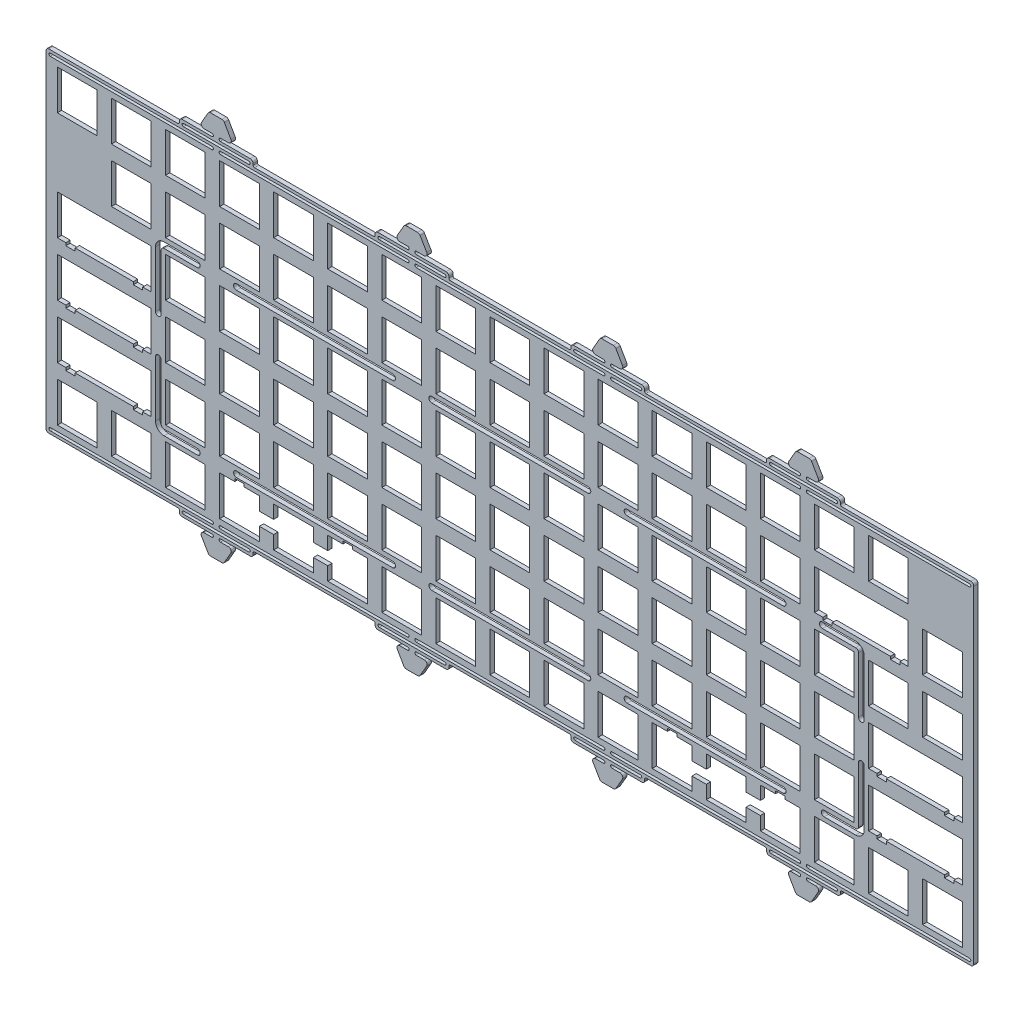
from build123d import *

# Parameters (mm, degrees)
SKETCH2_W           = 344.79935
SKETCH2_H           = 135.24936
SKETCH2_W_2         = 13.999
SKETCH2_H_2         = 14.00086
SKETCH2_W_3         = 14.001
SKETCH2_W_4         = 13.9993
SKETCH2_W_5         = 13.99955
SKETCH2_H_3         = 13.9994
SKETCH2_W_6         = 14.0007
SKETCH2_H_4         = 13.9993
SKETCH2_H_5         = 13.9992
BOSS_EXTRUDE1_DEPTH = 1.524
SKETCH3_W           = 388.73179045
SKETCH3_H           = 165.989329794
CUT_EXTRUDE1_DEPTH  = 186.195516218


with BuildPart() as part:
    # Sketch2 → Boss-Extrude1 (new body)
    with BuildSketch(Plane.XY):
        with Locations((-0.0007173, 0.0004735)):
            Rectangle(SKETCH2_W, SKETCH2_H)
        Polygon((102.2489577, -54.6242065), (102.2489577, -40.6233465), (96.8999577, -40.6233465), (96.8999577, -39.6545865), (93.5999577, -39.6545865), (93.5999577, -40.6233465), (88.2499577, -40.6233465), (88.2499577, -45.3238165), (83.1989577, -45.3238165), (83.1989577, -40.6233465), (69.1999577, -40.6233465), (69.1999577, -45.3238165), (64.1489577, -45.3238165), (64.1489577, -40.6233465), (58.8009577, -40.6233465), (58.8009577, -39.6545865), (55.4999577, -39.6545865), (55.4999577, -40.6233465), (50.1499577, -40.6233465), (50.1499577, -54.6242065), (64.1489577, -54.6242065), (64.1489577, -49.9223065), (69.1999577, -49.9223065), (69.1999577, -54.6242065), (83.1989577, -54.6242065), (83.1989577, -49.9223065), (88.2499577, -49.9223065), (88.2499577, -54.6242065), align=None, mode=Mode.SUBTRACT)
        Polygon((-50.1496423, -54.6242065), (-50.1496423, -40.6233465), (-55.4991423, -40.6233465), (-55.4991423, -39.6545865), (-58.7994423, -39.6545865), (-58.7994423, -40.6233465), (-64.1503423, -40.6233465), (-64.1503423, -45.3238165), (-69.2010423, -45.3238165), (-69.2010423, -40.6233465), (-83.2003423, -40.6233465), (-83.2003423, -45.3238165), (-88.2496423, -45.3238165), (-88.2496423, -40.6233465), (-93.6003423, -40.6233465), (-93.6003423, -39.6545865), (-96.9003423, -39.6545865), (-96.9003423, -40.6233465), (-102.2503423, -40.6233465), (-102.2503423, -54.6242065), (-88.2496423, -54.6242065), (-88.2496423, -49.9223065), (-83.2003423, -49.9223065), (-83.2003423, -54.6242065), (-69.2010423, -54.6242065), (-69.2010423, -49.9223065), (-64.1503423, -49.9223065), (-64.1503423, -54.6242065), align=None, mode=Mode.SUBTRACT)
        with Locations((152.3994577, -47.6237765)):
            Rectangle(SKETCH2_W_2, SKETCH2_H_2, mode=Mode.SUBTRACT)
        with Locations((133.3494577, -47.6237765)):
            Rectangle(SKETCH2_W_2, SKETCH2_H_2, mode=Mode.SUBTRACT)
        with Locations((114.2994577, -47.6237765)):
            Rectangle(SKETCH2_W_2, SKETCH2_H_2, mode=Mode.SUBTRACT)
        with Locations((38.0994577, -47.6237765)):
            Rectangle(SKETCH2_W_2, SKETCH2_H_2, mode=Mode.SUBTRACT)
        with Locations((19.0494577, -47.6237765)):
            Rectangle(SKETCH2_W_2, SKETCH2_H_2, mode=Mode.SUBTRACT)
        with Locations((-0.0005423, -47.6237765)):
            Rectangle(SKETCH2_W_2, SKETCH2_H_2, mode=Mode.SUBTRACT)
        with Locations((-19.0505423, -47.6237765)):
            Rectangle(SKETCH2_W_2, SKETCH2_H_2, mode=Mode.SUBTRACT)
        with Locations((-38.1015423, -47.6237765)):
            Rectangle(SKETCH2_W_3, SKETCH2_H_2, mode=Mode.SUBTRACT)
        with Locations((-114.3006923, -47.6237765)):
            Rectangle(SKETCH2_W_4, SKETCH2_H_2, mode=Mode.SUBTRACT)
        with Locations((-133.3506923, -47.6237765)):
            Rectangle(SKETCH2_W_4, SKETCH2_H_2, mode=Mode.SUBTRACT)
        with Locations((-152.4006173, -47.6237765)):
            Rectangle(SKETCH2_W_5, SKETCH2_H_2, mode=Mode.SUBTRACT)
        Polygon((126.3499577, -21.5748465), (126.3499577, -35.5742465), (129.3249577, -35.5742465), (129.3249577, -36.5443465), (132.6239577, -36.5443465), (132.6239577, -35.5742465), (153.1249577, -35.5742465), (153.1249577, -36.5443465), (156.4239577, -36.5443465), (156.4239577, -35.5742465), (159.3989577, -35.5742465), (159.3989577, -21.5748465), align=None, mode=Mode.SUBTRACT)
        Polygon((-159.4003923, -21.5748465), (-159.4003923, -35.5742465), (-156.4252023, -35.5742465), (-156.4252023, -36.5443465), (-153.1262023, -36.5443465), (-153.1262023, -35.5742465), (-132.6251423, -35.5742465), (-132.6251423, -36.5443465), (-129.3260423, -36.5443465), (-129.3260423, -35.5742465), (-126.3510423, -35.5742465), (-126.3510423, -21.5748465), align=None, mode=Mode.SUBTRACT)
        with Locations((114.2994577, -28.5745465)):
            Rectangle(SKETCH2_W_2, SKETCH2_H_3, mode=Mode.SUBTRACT)
        with Locations((95.2494577, -28.5745465)):
            Rectangle(SKETCH2_W_2, SKETCH2_H_3, mode=Mode.SUBTRACT)
        with Locations((76.1994577, -28.5745465)):
            Rectangle(SKETCH2_W_2, SKETCH2_H_3, mode=Mode.SUBTRACT)
        with Locations((57.1494577, -28.5745465)):
            Rectangle(SKETCH2_W_2, SKETCH2_H_3, mode=Mode.SUBTRACT)
        with Locations((38.0994577, -28.5745465)):
            Rectangle(SKETCH2_W_2, SKETCH2_H_3, mode=Mode.SUBTRACT)
        with Locations((19.0494577, -28.5745465)):
            Rectangle(SKETCH2_W_2, SKETCH2_H_3, mode=Mode.SUBTRACT)
        with Locations((-0.0005423, -28.5745465)):
            Rectangle(SKETCH2_W_2, SKETCH2_H_3, mode=Mode.SUBTRACT)
        with Locations((-19.0505423, -28.5745465)):
            Rectangle(SKETCH2_W_2, SKETCH2_H_3, mode=Mode.SUBTRACT)
        with Locations((-38.1015423, -28.5745465)):
            Rectangle(SKETCH2_W_3, SKETCH2_H_3, mode=Mode.SUBTRACT)
        with Locations((-57.1513923, -28.5745465)):
            Rectangle(SKETCH2_W_6, SKETCH2_H_3, mode=Mode.SUBTRACT)
        with Locations((-76.2006923, -28.5745465)):
            Rectangle(SKETCH2_W_4, SKETCH2_H_3, mode=Mode.SUBTRACT)
        with Locations((-95.2506923, -28.5745465)):
            Rectangle(SKETCH2_W_4, SKETCH2_H_3, mode=Mode.SUBTRACT)
        with Locations((-114.3006923, -28.5745465)):
            Rectangle(SKETCH2_W_4, SKETCH2_H_3, mode=Mode.SUBTRACT)
        Polygon((126.3499577, -2.5247465), (126.3499577, -16.5240465), (129.3249577, -16.5240465), (129.3249577, -17.4942465), (132.6239577, -17.4942465), (132.6239577, -16.5240465), (153.1249577, -16.5240465), (153.1249577, -17.4942465), (156.4239577, -17.4942465), (156.4239577, -16.5240465), (159.3989577, -16.5240465), (159.3989577, -2.5247465), align=None, mode=Mode.SUBTRACT)
        Polygon((-159.4003923, -2.5247465), (-159.4003923, -16.5240465), (-156.4252023, -16.5240465), (-156.4252023, -17.4942465), (-153.1262023, -17.4942465), (-153.1262023, -16.5240465), (-132.6251423, -16.5240465), (-132.6251423, -17.4942465), (-129.3260423, -17.4942465), (-129.3260423, -16.5240465), (-126.3510423, -16.5240465), (-126.3510423, -2.5247465), align=None, mode=Mode.SUBTRACT)
        with Locations((114.2994577, -9.5243965)):
            Rectangle(SKETCH2_W_2, SKETCH2_H_4, mode=Mode.SUBTRACT)
        with Locations((95.2494577, -9.5243965)):
            Rectangle(SKETCH2_W_2, SKETCH2_H_4, mode=Mode.SUBTRACT)
        with Locations((76.1994577, -9.5243965)):
            Rectangle(SKETCH2_W_2, SKETCH2_H_4, mode=Mode.SUBTRACT)
        with Locations((57.1494577, -9.5243965)):
            Rectangle(SKETCH2_W_2, SKETCH2_H_4, mode=Mode.SUBTRACT)
        with Locations((38.0994577, -9.5243965)):
            Rectangle(SKETCH2_W_2, SKETCH2_H_4, mode=Mode.SUBTRACT)
        with Locations((19.0494577, -9.5243965)):
            Rectangle(SKETCH2_W_2, SKETCH2_H_4, mode=Mode.SUBTRACT)
        with Locations((-0.0005423, -9.5243965)):
            Rectangle(SKETCH2_W_2, SKETCH2_H_4, mode=Mode.SUBTRACT)
        with Locations((-19.0505423, -9.5243965)):
            Rectangle(SKETCH2_W_2, SKETCH2_H_4, mode=Mode.SUBTRACT)
        with Locations((-38.1015423, -9.5243965)):
            Rectangle(SKETCH2_W_3, SKETCH2_H_4, mode=Mode.SUBTRACT)
        with Locations((-57.1513923, -9.5243965)):
            Rectangle(SKETCH2_W_6, SKETCH2_H_4, mode=Mode.SUBTRACT)
        with Locations((-76.2006923, -9.5243965)):
            Rectangle(SKETCH2_W_4, SKETCH2_H_4, mode=Mode.SUBTRACT)
        with Locations((-95.2506923, -9.5243965)):
            Rectangle(SKETCH2_W_4, SKETCH2_H_4, mode=Mode.SUBTRACT)
        with Locations((-114.3006923, -9.5243965)):
            Rectangle(SKETCH2_W_4, SKETCH2_H_4, mode=Mode.SUBTRACT)
        Polygon((-159.4003923, 16.5252535), (-159.4003923, 2.5259535), (-156.4252023, 2.5259535), (-156.4252023, 1.5557535), (-153.1262023, 1.5557535), (-153.1262023, 2.5259535), (-132.6251423, 2.5259535), (-132.6251423, 1.5557535), (-129.3260423, 1.5557535), (-129.3260423, 2.5259535), (-126.3510423, 2.5259535), (-126.3510423, 16.5252535), align=None, mode=Mode.SUBTRACT)
        with Locations((152.3994577, 9.5256035)):
            Rectangle(SKETCH2_W_2, SKETCH2_H_4, mode=Mode.SUBTRACT)
        with Locations((133.3494577, 9.5256035)):
            Rectangle(SKETCH2_W_2, SKETCH2_H_4, mode=Mode.SUBTRACT)
        with Locations((114.2994577, 9.5256035)):
            Rectangle(SKETCH2_W_2, SKETCH2_H_4, mode=Mode.SUBTRACT)
        with Locations((95.2494577, 9.5256035)):
            Rectangle(SKETCH2_W_2, SKETCH2_H_4, mode=Mode.SUBTRACT)
        with Locations((76.1994577, 9.5256035)):
            Rectangle(SKETCH2_W_2, SKETCH2_H_4, mode=Mode.SUBTRACT)
        with Locations((57.1494577, 9.5256035)):
            Rectangle(SKETCH2_W_2, SKETCH2_H_4, mode=Mode.SUBTRACT)
        with Locations((38.0994577, 9.5256035)):
            Rectangle(SKETCH2_W_2, SKETCH2_H_4, mode=Mode.SUBTRACT)
        with Locations((19.0494577, 9.5256035)):
            Rectangle(SKETCH2_W_2, SKETCH2_H_4, mode=Mode.SUBTRACT)
        with Locations((-0.0005423, 9.5256035)):
            Rectangle(SKETCH2_W_2, SKETCH2_H_4, mode=Mode.SUBTRACT)
        with Locations((-19.0505423, 9.5256035)):
            Rectangle(SKETCH2_W_2, SKETCH2_H_4, mode=Mode.SUBTRACT)
        with Locations((-38.1015423, 9.5256035)):
            Rectangle(SKETCH2_W_3, SKETCH2_H_4, mode=Mode.SUBTRACT)
        with Locations((-57.1513923, 9.5256035)):
            Rectangle(SKETCH2_W_6, SKETCH2_H_4, mode=Mode.SUBTRACT)
        with Locations((-76.2006923, 9.5256035)):
            Rectangle(SKETCH2_W_4, SKETCH2_H_4, mode=Mode.SUBTRACT)
        with Locations((-95.2506923, 9.5256035)):
            Rectangle(SKETCH2_W_4, SKETCH2_H_4, mode=Mode.SUBTRACT)
        with Locations((-114.3006923, 9.5256035)):
            Rectangle(SKETCH2_W_4, SKETCH2_H_4, mode=Mode.SUBTRACT)
        Polygon((107.2999577, 35.5752535), (107.2999577, 21.5759535), (110.2749577, 21.5759535), (110.2749577, 20.6057535), (113.5739577, 20.6057535), (113.5739577, 21.5759535), (134.0749577, 21.5759535), (134.0749577, 20.6057535), (137.3739577, 20.6057535), (137.3739577, 21.5759535), (140.3489577, 21.5759535), (140.3489577, 35.5752535), align=None, mode=Mode.SUBTRACT)
        with Locations((152.3994577, 28.5756035)):
            Rectangle(SKETCH2_W_2, SKETCH2_H_4, mode=Mode.SUBTRACT)
        with Locations((95.2494577, 28.5756035)):
            Rectangle(SKETCH2_W_2, SKETCH2_H_4, mode=Mode.SUBTRACT)
        with Locations((76.1994577, 28.5756035)):
            Rectangle(SKETCH2_W_2, SKETCH2_H_4, mode=Mode.SUBTRACT)
        with Locations((57.1494577, 28.5756035)):
            Rectangle(SKETCH2_W_2, SKETCH2_H_4, mode=Mode.SUBTRACT)
        with Locations((38.0994577, 28.5756035)):
            Rectangle(SKETCH2_W_2, SKETCH2_H_4, mode=Mode.SUBTRACT)
        with Locations((19.0494577, 28.5756035)):
            Rectangle(SKETCH2_W_2, SKETCH2_H_4, mode=Mode.SUBTRACT)
        with Locations((-0.0005423, 28.5756035)):
            Rectangle(SKETCH2_W_2, SKETCH2_H_4, mode=Mode.SUBTRACT)
        with Locations((-19.0505423, 28.5756035)):
            Rectangle(SKETCH2_W_2, SKETCH2_H_4, mode=Mode.SUBTRACT)
        with Locations((-38.1015423, 28.5756035)):
            Rectangle(SKETCH2_W_3, SKETCH2_H_4, mode=Mode.SUBTRACT)
        with Locations((-57.1513923, 28.5756035)):
            Rectangle(SKETCH2_W_6, SKETCH2_H_4, mode=Mode.SUBTRACT)
        with Locations((-76.2006923, 28.5756035)):
            Rectangle(SKETCH2_W_4, SKETCH2_H_4, mode=Mode.SUBTRACT)
        with Locations((-95.2506923, 28.5756035)):
            Rectangle(SKETCH2_W_4, SKETCH2_H_4, mode=Mode.SUBTRACT)
        with Locations((-114.3006923, 28.5756035)):
            Rectangle(SKETCH2_W_4, SKETCH2_H_4, mode=Mode.SUBTRACT)
        with Locations((-133.3506923, 28.5756035)):
            Rectangle(SKETCH2_W_4, SKETCH2_H_4, mode=Mode.SUBTRACT)
        with Locations((133.3494577, 47.6255535)):
            Rectangle(SKETCH2_W_2, SKETCH2_H_5, mode=Mode.SUBTRACT)
        with Locations((114.2994577, 47.6255535)):
            Rectangle(SKETCH2_W_2, SKETCH2_H_5, mode=Mode.SUBTRACT)
        with Locations((95.2494577, 47.6255535)):
            Rectangle(SKETCH2_W_2, SKETCH2_H_5, mode=Mode.SUBTRACT)
        with Locations((76.1994577, 47.6255535)):
            Rectangle(SKETCH2_W_2, SKETCH2_H_5, mode=Mode.SUBTRACT)
        with Locations((57.1494577, 47.6255535)):
            Rectangle(SKETCH2_W_2, SKETCH2_H_5, mode=Mode.SUBTRACT)
        with Locations((38.0994577, 47.6255535)):
            Rectangle(SKETCH2_W_2, SKETCH2_H_5, mode=Mode.SUBTRACT)
        with Locations((19.0494577, 47.6255535)):
            Rectangle(SKETCH2_W_2, SKETCH2_H_5, mode=Mode.SUBTRACT)
        with Locations((-0.0005423, 47.6255535)):
            Rectangle(SKETCH2_W_2, SKETCH2_H_5, mode=Mode.SUBTRACT)
        with Locations((-19.0505423, 47.6255535)):
            Rectangle(SKETCH2_W_2, SKETCH2_H_5, mode=Mode.SUBTRACT)
        with Locations((-38.1015423, 47.6255535)):
            Rectangle(SKETCH2_W_3, SKETCH2_H_5, mode=Mode.SUBTRACT)
        with Locations((-57.1513923, 47.6255535)):
            Rectangle(SKETCH2_W_6, SKETCH2_H_5, mode=Mode.SUBTRACT)
        with Locations((-76.2006923, 47.6255535)):
            Rectangle(SKETCH2_W_4, SKETCH2_H_5, mode=Mode.SUBTRACT)
        with Locations((-95.2506923, 47.6255535)):
            Rectangle(SKETCH2_W_4, SKETCH2_H_5, mode=Mode.SUBTRACT)
        with Locations((-114.3006923, 47.6255535)):
            Rectangle(SKETCH2_W_4, SKETCH2_H_5, mode=Mode.SUBTRACT)
        with Locations((-133.3506923, 47.6255535)):
            Rectangle(SKETCH2_W_4, SKETCH2_H_5, mode=Mode.SUBTRACT)
        with Locations((-152.4006173, 47.6255535)):
            Rectangle(SKETCH2_W_5, SKETCH2_H_5, mode=Mode.SUBTRACT)
    extrude(amount=BOSS_EXTRUDE1_DEPTH)

    # Sketch3 → Cut-Extrude1 (cut, through all)
    # profile 1 of 29: a face of its own
    with BuildSketch(Plane.XY.offset(1.524)):
        Rectangle(SKETCH3_W, SKETCH3_H)
        with BuildLine():
            ThreePointArc((-105.4405223, -67.6242065), (-105.9405223, -67.490231904), (-106.306547704, -67.1242065))
            Line((-106.306547704, -67.1242065), (-108.615948781, -63.1242065))
            ThreePointArc((-108.615948781, -63.1242065), (-108.615948781, -62.1242065), (-107.749923377, -61.6242065))
            Line((-107.749923377, -61.6242065), (-104.9405223, -61.6242065))
            ThreePointArc((-104.9405223, -61.6242065), (-104.4405223, -61.1242065), (-104.9405223, -60.6242065))
            Line((-104.9405223, -60.6242065), (-115.4405223, -60.6242065))
            ThreePointArc((-115.4405223, -60.6242065), (-116.147629081, -60.331313281), (-116.4405223, -59.6242065))
            Line((-116.4405223, -59.6242065), (-116.4405223, -59.1241965))
            ThreePointArc((-116.4405223, -59.1241965), (-116.58696598, -58.77065018), (-116.9405123, -58.6242065))
            Line((-116.9405123, -58.6242065), (-162.4003923, -58.6242065))
            ThreePointArc((-162.4003923, -58.6242065), (-163.107499081, -58.331313281), (-163.4003923, -57.6242065))
            Line((-163.4003923, -57.6242065), (-163.4003923, 57.6242065))
            ThreePointArc((-163.4003923, 57.6242065), (-163.107499081, 58.331313281), (-162.4003923, 58.6242065))
            Line((-162.4003923, 58.6242065), (-116.9405123, 58.6242065))
            ThreePointArc((-116.9405123, 58.6242065), (-116.58696598, 58.77065018), (-116.4405223, 59.1241965))
            Line((-116.4405223, 59.1241965), (-116.4405223, 59.6242065))
            ThreePointArc((-116.4405223, 59.6242065), (-116.147629081, 60.331313281), (-115.4405223, 60.6242065))
            Line((-115.4405223, 60.6242065), (-104.9405223, 60.6242065))
            ThreePointArc((-104.9405223, 60.6242065), (-104.4405223, 61.1242065), (-104.9405223, 61.6242065))
            Line((-104.9405223, 61.6242065), (-107.749923377, 61.6242065))
            ThreePointArc((-107.749923377, 61.6242065), (-108.615948781, 62.1242065), (-108.615948781, 63.1242065))
            Line((-108.615948781, 63.1242065), (-106.306547704, 67.1242065))
            ThreePointArc((-106.306547704, 67.1242065), (-105.9405223, 67.490231904), (-105.4405223, 67.6242065))
            Line((-105.4405223, 67.6242065), (-101.4405223, 67.6242065))
            ThreePointArc((-101.4405223, 67.6242065), (-100.9405223, 67.490231904), (-100.574496896, 67.1242065))
            Line((-100.574496896, 67.1242065), (-98.265095819, 63.1242065))
            ThreePointArc((-98.265095819, 63.1242065), (-98.265095819, 62.1242065), (-99.131121223, 61.6242065))
            Line((-99.131121223, 61.6242065), (-101.9405223, 61.6242065))
            ThreePointArc((-101.9405223, 61.6242065), (-102.4405223, 61.1242065), (-101.9405223, 60.6242065))
            Line((-101.9405223, 60.6242065), (-91.4405223, 60.6242065))
            ThreePointArc((-91.4405223, 60.6242065), (-90.733415519, 60.331313281), (-90.4405223, 59.6242065))
            Line((-90.4405223, 59.6242065), (-90.4405223, 59.1241965))
            ThreePointArc((-90.4405223, 59.1241965), (-90.29407862, 58.77065018), (-89.9405323, 58.6242065))
            Line((-89.9405323, 58.6242065), (-47.9806423, 58.6242065))
            ThreePointArc((-47.9806423, 58.6242065), (-47.62709598, 58.77065018), (-47.4806523, 59.1241965))
            Line((-47.4806523, 59.1241965), (-47.4806523, 59.6242065))
            ThreePointArc((-47.4806523, 59.6242065), (-47.187759081, 60.331313281), (-46.4806523, 60.6242065))
            Line((-46.4806523, 60.6242065), (-35.9806523, 60.6242065))
            ThreePointArc((-35.9806523, 60.6242065), (-35.4806523, 61.1242065), (-35.9806523, 61.6242065))
            Line((-35.9806523, 61.6242065), (-38.790053377, 61.6242065))
            ThreePointArc((-38.790053377, 61.6242065), (-39.656078781, 62.1242065), (-39.656078781, 63.1242065))
            Line((-39.656078781, 63.1242065), (-37.346677704, 67.1242065))
            ThreePointArc((-37.346677704, 67.1242065), (-36.9806523, 67.490231904), (-36.4806523, 67.6242065))
            Line((-36.4806523, 67.6242065), (-32.4806523, 67.6242065))
            ThreePointArc((-32.4806523, 67.6242065), (-31.9806523, 67.490231904), (-31.614626896, 67.1242065))
            Line((-31.614626896, 67.1242065), (-29.305225819, 63.1242065))
            ThreePointArc((-29.305225819, 63.1242065), (-29.305225819, 62.1242065), (-30.171251223, 61.6242065))
            Line((-30.171251223, 61.6242065), (-32.9806523, 61.6242065))
            ThreePointArc((-32.9806523, 61.6242065), (-33.4806523, 61.1242065), (-32.9806523, 60.6242065))
            Line((-32.9806523, 60.6242065), (-22.4806523, 60.6242065))
            ThreePointArc((-22.4806523, 60.6242065), (-21.773545519, 60.331313281), (-21.4806523, 59.6242065))
            Line((-21.4806523, 59.6242065), (-21.4806523, 59.1241965))
            ThreePointArc((-21.4806523, 59.1241965), (-21.33420862, 58.77065018), (-20.9806623, 58.6242065))
            Line((-20.9806623, 58.6242065), (20.9792277, 58.6242065))
            ThreePointArc((20.9792277, 58.6242065), (21.33277402, 58.77065018), (21.4792177, 59.1241965))
            Line((21.4792177, 59.1241965), (21.4792177, 59.6242065))
            ThreePointArc((21.4792177, 59.6242065), (21.772110919, 60.331313281), (22.4792177, 60.6242065))
            Line((22.4792177, 60.6242065), (32.9792177, 60.6242065))
            ThreePointArc((32.9792177, 60.6242065), (33.4792177, 61.1242065), (32.9792177, 61.6242065))
            Line((32.9792177, 61.6242065), (30.169816623, 61.6242065))
            ThreePointArc((30.169816623, 61.6242065), (29.303791219, 62.1242065), (29.303791219, 63.1242065))
            Line((29.303791219, 63.1242065), (31.613192296, 67.1242065))
            ThreePointArc((31.613192296, 67.1242065), (31.9792177, 67.490231904), (32.4792177, 67.6242065))
            Line((32.4792177, 67.6242065), (36.4792177, 67.6242065))
            ThreePointArc((36.4792177, 67.6242065), (36.9792177, 67.490231904), (37.345243104, 67.1242065))
            Line((37.345243104, 67.1242065), (39.654644181, 63.1242065))
            ThreePointArc((39.654644181, 63.1242065), (39.654644181, 62.1242065), (38.788618777, 61.6242065))
            Line((38.788618777, 61.6242065), (35.9792177, 61.6242065))
            ThreePointArc((35.9792177, 61.6242065), (35.4792177, 61.1242065), (35.9792177, 60.6242065))
            Line((35.9792177, 60.6242065), (46.4792177, 60.6242065))
            ThreePointArc((46.4792177, 60.6242065), (47.186324481, 60.331313281), (47.4792177, 59.6242065))
            Line((47.4792177, 59.6242065), (47.4792177, 59.1241965))
            ThreePointArc((47.4792177, 59.1241965), (47.62566138, 58.77065018), (47.9792077, 58.6242065))
            Line((47.9792077, 58.6242065), (89.9390977, 58.6242065))
            ThreePointArc((89.9390977, 58.6242065), (90.29264402, 58.77065018), (90.4390877, 59.1241965))
            Line((90.4390877, 59.1241965), (90.4390877, 59.6242065))
            ThreePointArc((90.4390877, 59.6242065), (90.731980919, 60.331313281), (91.4390877, 60.6242065))
            Line((91.4390877, 60.6242065), (101.9390877, 60.6242065))
            ThreePointArc((101.9390877, 60.6242065), (102.4390877, 61.1242065), (101.9390877, 61.6242065))
            Line((101.9390877, 61.6242065), (99.129686623, 61.6242065))
            ThreePointArc((99.129686623, 61.6242065), (98.263661219, 62.1242065), (98.263661219, 63.1242065))
            Line((98.263661219, 63.1242065), (100.573062296, 67.1242065))
            ThreePointArc((100.573062296, 67.1242065), (100.9390877, 67.490231904), (101.4390877, 67.6242065))
            Line((101.4390877, 67.6242065), (105.4390877, 67.6242065))
            ThreePointArc((105.4390877, 67.6242065), (105.9390877, 67.490231904), (106.305113104, 67.1242065))
            Line((106.305113104, 67.1242065), (108.614514181, 63.1242065))
            ThreePointArc((108.614514181, 63.1242065), (108.614514181, 62.1242065), (107.748488777, 61.6242065))
            Line((107.748488777, 61.6242065), (104.9390877, 61.6242065))
            ThreePointArc((104.9390877, 61.6242065), (104.4390877, 61.1242065), (104.9390877, 60.6242065))
            Line((104.9390877, 60.6242065), (115.4390877, 60.6242065))
            ThreePointArc((115.4390877, 60.6242065), (116.146194481, 60.331313281), (116.4390877, 59.6242065))
            Line((116.4390877, 59.6242065), (116.4390877, 59.1241965))
            ThreePointArc((116.4390877, 59.1241965), (116.58553138, 58.77065018), (116.9390777, 58.6242065))
            Line((116.9390777, 58.6242065), (162.3989577, 58.6242065))
            ThreePointArc((162.3989577, 58.6242065), (163.106064481, 58.331313281), (163.3989577, 57.6242065))
            Line((163.3989577, 57.6242065), (163.3989577, -57.6242065))
            ThreePointArc((163.3989577, -57.6242065), (163.106064481, -58.331313281), (162.3989577, -58.6242065))
            Line((162.3989577, -58.6242065), (116.9390777, -58.6242065))
            ThreePointArc((116.9390777, -58.6242065), (116.58553138, -58.77065018), (116.4390877, -59.1241965))
            Line((116.4390877, -59.1241965), (116.4390877, -59.6242065))
            ThreePointArc((116.4390877, -59.6242065), (116.146194481, -60.331313281), (115.4390877, -60.6242065))
            Line((115.4390877, -60.6242065), (104.9390877, -60.6242065))
            ThreePointArc((104.9390877, -60.6242065), (104.4390877, -61.1242065), (104.9390877, -61.6242065))
            Line((104.9390877, -61.6242065), (107.748488777, -61.6242065))
            ThreePointArc((107.748488777, -61.6242065), (108.614514181, -62.1242065), (108.614514181, -63.1242065))
            Line((108.614514181, -63.1242065), (106.305113104, -67.1242065))
            ThreePointArc((106.305113104, -67.1242065), (105.9390877, -67.490231904), (105.4390877, -67.6242065))
            Line((105.4390877, -67.6242065), (101.4390877, -67.6242065))
            ThreePointArc((101.4390877, -67.6242065), (100.9390877, -67.490231904), (100.573062296, -67.1242065))
            Line((100.573062296, -67.1242065), (98.263661219, -63.1242065))
            ThreePointArc((98.263661219, -63.1242065), (98.263661219, -62.1242065), (99.129686623, -61.6242065))
            Line((99.129686623, -61.6242065), (101.9390877, -61.6242065))
            ThreePointArc((101.9390877, -61.6242065), (102.4390877, -61.1242065), (101.9390877, -60.6242065))
            Line((101.9390877, -60.6242065), (91.4390877, -60.6242065))
            ThreePointArc((91.4390877, -60.6242065), (90.731980919, -60.331313281), (90.4390877, -59.6242065))
            Line((90.4390877, -59.6242065), (90.4390877, -59.1241965))
            ThreePointArc((90.4390877, -59.1241965), (90.29264402, -58.77065018), (89.9390977, -58.6242065))
            Line((89.9390977, -58.6242065), (47.9792077, -58.6242065))
            ThreePointArc((47.9792077, -58.6242065), (47.62566138, -58.77065018), (47.4792177, -59.1241965))
            Line((47.4792177, -59.1241965), (47.4792177, -59.6242065))
            ThreePointArc((47.4792177, -59.6242065), (47.186324481, -60.331313281), (46.4792177, -60.6242065))
            Line((46.4792177, -60.6242065), (35.9792177, -60.6242065))
            ThreePointArc((35.9792177, -60.6242065), (35.4792177, -61.1242065), (35.9792177, -61.6242065))
            Line((35.9792177, -61.6242065), (38.788618777, -61.6242065))
            ThreePointArc((38.788618777, -61.6242065), (39.654644181, -62.1242065), (39.654644181, -63.1242065))
            Line((39.654644181, -63.1242065), (37.345243104, -67.1242065))
            ThreePointArc((37.345243104, -67.1242065), (36.9792177, -67.490231904), (36.4792177, -67.6242065))
            Line((36.4792177, -67.6242065), (32.4792177, -67.6242065))
            ThreePointArc((32.4792177, -67.6242065), (31.9792177, -67.490231904), (31.613192296, -67.1242065))
            Line((31.613192296, -67.1242065), (29.303791219, -63.1242065))
            ThreePointArc((29.303791219, -63.1242065), (29.303791219, -62.1242065), (30.169816623, -61.6242065))
            Line((30.169816623, -61.6242065), (32.9792177, -61.6242065))
            ThreePointArc((32.9792177, -61.6242065), (33.4792177, -61.1242065), (32.9792177, -60.6242065))
            Line((32.9792177, -60.6242065), (22.4792177, -60.6242065))
            ThreePointArc((22.4792177, -60.6242065), (21.772110919, -60.331313281), (21.4792177, -59.6242065))
            Line((21.4792177, -59.6242065), (21.4792177, -59.1241965))
            ThreePointArc((21.4792177, -59.1241965), (21.33277402, -58.77065018), (20.9792277, -58.6242065))
            Line((20.9792277, -58.6242065), (-20.9806623, -58.6242065))
            ThreePointArc((-20.9806623, -58.6242065), (-21.33420862, -58.77065018), (-21.4806523, -59.1241965))
            Line((-21.4806523, -59.1241965), (-21.4806523, -59.6242065))
            ThreePointArc((-21.4806523, -59.6242065), (-21.773545519, -60.331313281), (-22.4806523, -60.6242065))
            Line((-22.4806523, -60.6242065), (-32.9806523, -60.6242065))
            ThreePointArc((-32.9806523, -60.6242065), (-33.4806523, -61.1242065), (-32.9806523, -61.6242065))
            Line((-32.9806523, -61.6242065), (-30.171251223, -61.6242065))
            ThreePointArc((-30.171251223, -61.6242065), (-29.305225819, -62.1242065), (-29.305225819, -63.1242065))
            Line((-29.305225819, -63.1242065), (-31.614626896, -67.1242065))
            ThreePointArc((-31.614626896, -67.1242065), (-31.9806523, -67.490231904), (-32.4806523, -67.6242065))
            Line((-32.4806523, -67.6242065), (-36.4806523, -67.6242065))
            ThreePointArc((-36.4806523, -67.6242065), (-36.9806523, -67.490231904), (-37.346677704, -67.1242065))
            Line((-37.346677704, -67.1242065), (-39.656078781, -63.1242065))
            ThreePointArc((-39.656078781, -63.1242065), (-39.656078781, -62.1242065), (-38.790053377, -61.6242065))
            Line((-38.790053377, -61.6242065), (-35.9806523, -61.6242065))
            ThreePointArc((-35.9806523, -61.6242065), (-35.4806523, -61.1242065), (-35.9806523, -60.6242065))
            Line((-35.9806523, -60.6242065), (-46.4806523, -60.6242065))
            ThreePointArc((-46.4806523, -60.6242065), (-47.187759081, -60.331313281), (-47.4806523, -59.6242065))
            Line((-47.4806523, -59.6242065), (-47.4806523, -59.1241965))
            ThreePointArc((-47.4806523, -59.1241965), (-47.62709598, -58.77065018), (-47.9806423, -58.6242065))
            Line((-47.9806423, -58.6242065), (-89.9405323, -58.6242065))
            ThreePointArc((-89.9405323, -58.6242065), (-90.29407862, -58.77065018), (-90.4405223, -59.1241965))
            Line((-90.4405223, -59.1241965), (-90.4405223, -59.6242065))
            ThreePointArc((-90.4405223, -59.6242065), (-90.733415519, -60.331313281), (-91.4405223, -60.6242065))
            Line((-91.4405223, -60.6242065), (-101.9405223, -60.6242065))
            ThreePointArc((-101.9405223, -60.6242065), (-102.4405223, -61.1242065), (-101.9405223, -61.6242065))
            Line((-101.9405223, -61.6242065), (-99.131121223, -61.6242065))
            ThreePointArc((-99.131121223, -61.6242065), (-98.265095819, -62.1242065), (-98.265095819, -63.1242065))
            Line((-98.265095819, -63.1242065), (-100.574496896, -67.1242065))
            ThreePointArc((-100.574496896, -67.1242065), (-100.9405223, -67.490231904), (-101.4405223, -67.6242065))
            Line((-101.4405223, -67.6242065), (-105.4405223, -67.6242065))
        make_face(mode=Mode.SUBTRACT)
    # profile 2 of 29: a face of its own
    with BuildSketch(Plane.XY.offset(1.524)):
        with BuildLine():
            Line((110.066116033, 18.0506035), (121.8244577, 18.0506035))
            ThreePointArc((121.8244577, 18.0506035), (122.531564481, 17.757710281), (122.8244577, 17.0506035))
            Line((122.8244577, 17.0506035), (122.8244577, -2.6440965))
            ThreePointArc((122.8244577, -2.6440965), (123.8244577, -3.6440965), (124.8244577, -2.6440965))
            Line((124.8244577, -2.6440965), (124.8244577, 17.0506035))
            ThreePointArc((124.8244577, 17.0506035), (123.945778044, 19.171923844), (121.8244577, 20.0506035))
            Line((121.8244577, 20.0506035), (110.066116033, 20.0506035))
            ThreePointArc((110.066116033, 20.0506035), (109.066116033, 19.0506035), (110.066116033, 18.0506035))
        make_face()
    # profile 3 of 29: a face of its own
    with BuildSketch(Plane.XY.offset(1.524)):
        with BuildLine():
            ThreePointArc((110.718180633, -37.0987965), (109.718180633, -38.0987965), (110.718180633, -39.0987965))
            Line((110.718180633, -39.0987965), (121.8244577, -39.0987965))
            ThreePointArc((121.8244577, -39.0987965), (123.945778044, -38.220116844), (124.8244577, -36.0987965))
            Line((124.8244577, -36.0987965), (124.8244577, -16.4040965))
            ThreePointArc((124.8244577, -16.4040965), (123.8244577, -15.4040965), (122.8244577, -16.4040965))
            Line((122.8244577, -16.4040965), (122.8244577, -36.0987965))
            ThreePointArc((122.8244577, -36.0987965), (122.531564481, -36.805903281), (121.8244577, -37.0987965))
            Line((121.8244577, -37.0987965), (110.718180633, -37.0987965))
        make_face()
    # profile 4 of 29: a face of its own
    with BuildSketch(Plane.XY.offset(1.524)):
        with BuildLine():
            ThreePointArc((-110.067350633, 18.0506035), (-109.067350633, 19.0506035), (-110.067350633, 20.0506035))
            Line((-110.067350633, 20.0506035), (-121.8256923, 20.0506035))
            ThreePointArc((-121.8256923, 20.0506035), (-123.947012644, 19.171923844), (-124.8256923, 17.0506035))
            Line((-124.8256923, 17.0506035), (-124.8256923, -2.6440965))
            ThreePointArc((-124.8256923, -2.6440965), (-123.8256923, -3.6440965), (-122.8256923, -2.6440965))
            Line((-122.8256923, -2.6440965), (-122.8256923, 17.0506035))
            ThreePointArc((-122.8256923, 17.0506035), (-122.532799081, 17.757710281), (-121.8256923, 18.0506035))
            Line((-121.8256923, 18.0506035), (-110.067350633, 18.0506035))
        make_face()
    # profile 5 of 29: a face of its own
    with BuildSketch(Plane.XY.offset(1.524)):
        with BuildLine():
            ThreePointArc((41.2744077, -37.0987965), (40.2744077, -38.0987965), (41.2744077, -39.0987965))
            Line((41.2744077, -39.0987965), (96.307774367, -39.0987965))
            ThreePointArc((96.307774367, -39.0987965), (97.307774367, -38.0987965), (96.307774367, -37.0987965))
            Line((96.307774367, -37.0987965), (41.2744077, -37.0987965))
        make_face()
    # profile 6 of 29: a face of its own
    with BuildSketch(Plane.XY.offset(1.524)):
        with BuildLine():
            ThreePointArc((-27.517300633, -37.0987965), (-28.517300633, -38.0987965), (-27.517300633, -39.0987965))
            Line((-27.517300633, -39.0987965), (27.516066033, -39.0987965))
            ThreePointArc((27.516066033, -39.0987965), (28.516066033, -38.0987965), (27.516066033, -37.0987965))
            Line((27.516066033, -37.0987965), (-27.517300633, -37.0987965))
        make_face()
    # profile 7 of 29: a face of its own
    with BuildSketch(Plane.XY.offset(1.524)):
        with BuildLine():
            ThreePointArc((-96.309008967, -37.0987965), (-97.309008967, -38.0987965), (-96.309008967, -39.0987965))
            Line((-96.309008967, -39.0987965), (-41.2756423, -39.0987965))
            ThreePointArc((-41.2756423, -39.0987965), (-40.2756423, -38.0987965), (-41.2756423, -37.0987965))
            Line((-41.2756423, -37.0987965), (-96.309008967, -37.0987965))
        make_face()
    # profile 8 of 29: a face of its own
    with BuildSketch(Plane.XY.offset(1.524)):
        with BuildLine():
            ThreePointArc((41.2744077, 20.0506035), (40.2744077, 19.0506035), (41.2744077, 18.0506035))
            Line((41.2744077, 18.0506035), (96.307774367, 18.0506035))
            ThreePointArc((96.307774367, 18.0506035), (97.307774367, 19.0506035), (96.307774367, 20.0506035))
            Line((96.307774367, 20.0506035), (41.2744077, 20.0506035))
        make_face()
    # profile 9 of 29: a face of its own
    with BuildSketch(Plane.XY.offset(1.524)):
        with BuildLine():
            ThreePointArc((-96.309008967, 20.0506035), (-97.309008967, 19.0506035), (-96.309008967, 18.0506035))
            Line((-96.309008967, 18.0506035), (-41.2756423, 18.0506035))
            ThreePointArc((-41.2756423, 18.0506035), (-40.2756423, 19.0506035), (-41.2756423, 20.0506035))
            Line((-41.2756423, 20.0506035), (-96.309008967, 20.0506035))
        make_face()
    # profile 10 of 29: a face of its own
    with BuildSketch(Plane.XY.offset(1.524)):
        with BuildLine():
            ThreePointArc((-27.517300633, 20.0506035), (-28.517300633, 19.0506035), (-27.517300633, 18.0506035))
            Line((-27.517300633, 18.0506035), (27.516066033, 18.0506035))
            ThreePointArc((27.516066033, 18.0506035), (28.516066033, 19.0506035), (27.516066033, 20.0506035))
            Line((27.516066033, 20.0506035), (-27.517300633, 20.0506035))
        make_face()
    # profile 11 of 29: a face of its own
    with BuildSketch(Plane.XY.offset(1.524)):
        with BuildLine():
            Line((-110.067350633, -37.0987965), (-121.8256923, -37.0987965))
            ThreePointArc((-121.8256923, -37.0987965), (-122.532799081, -36.805903281), (-122.8256923, -36.0987965))
            Line((-122.8256923, -36.0987965), (-122.8256923, -16.4040965))
            ThreePointArc((-122.8256923, -16.4040965), (-123.8256923, -15.4040965), (-124.8256923, -16.4040965))
            Line((-124.8256923, -16.4040965), (-124.8256923, -36.0987965))
            ThreePointArc((-124.8256923, -36.0987965), (-123.947012644, -38.220116844), (-121.8256923, -39.0987965))
            Line((-121.8256923, -39.0987965), (-110.067350633, -39.0987965))
            ThreePointArc((-110.067350633, -39.0987965), (-109.067350633, -38.0987965), (-110.067350633, -37.0987965))
        make_face()
    # profile 12 of 29: a face of its own
    with BuildSketch(Plane.XY.offset(1.524)):
        with BuildLine():
            ThreePointArc((-161.90456195, 57.6242065), (-162.40456195, 57.1242065), (-161.90456195, 56.6242065))
            Line((-161.90456195, 56.6242065), (-104.9405223, 56.6242065))
            ThreePointArc((-104.9405223, 56.6242065), (-104.4405223, 57.1242065), (-104.9405223, 57.6242065))
            Line((-104.9405223, 57.6242065), (-161.90456195, 57.6242065))
        make_face()
    # profile 13 of 29: a face of its own
    with BuildSketch(Plane.XY.offset(1.524)):
        with BuildLine():
            ThreePointArc((-101.9405223, 57.6242065), (-102.4405223, 57.1242065), (-101.9405223, 56.6242065))
            Line((-101.9405223, 56.6242065), (-35.9806523, 56.6242065))
            ThreePointArc((-35.9806523, 56.6242065), (-35.4806523, 57.1242065), (-35.9806523, 57.6242065))
            Line((-35.9806523, 57.6242065), (-101.9405223, 57.6242065))
        make_face()
    # profile 14 of 29: a face of its own
    with BuildSketch(Plane.XY.offset(1.524)):
        with BuildLine():
            Line((32.9792177, 57.6242065), (-32.9806523, 57.6242065))
            ThreePointArc((-32.9806523, 57.6242065), (-33.4806523, 57.1242065), (-32.9806523, 56.6242065))
            Line((-32.9806523, 56.6242065), (32.9792177, 56.6242065))
            ThreePointArc((32.9792177, 56.6242065), (33.4792177, 57.1242065), (32.9792177, 57.6242065))
        make_face()
    # profile 15 of 29: a face of its own
    with BuildSketch(Plane.XY.offset(1.524)):
        with BuildLine():
            Line((101.9390877, 57.6242065), (35.9792177, 57.6242065))
            ThreePointArc((35.9792177, 57.6242065), (35.4792177, 57.1242065), (35.9792177, 56.6242065))
            Line((35.9792177, 56.6242065), (101.9390877, 56.6242065))
            ThreePointArc((101.9390877, 56.6242065), (102.4390877, 57.1242065), (101.9390877, 57.6242065))
        make_face()
    # profile 16 of 29: a face of its own
    with BuildSketch(Plane.XY.offset(1.524)):
        with BuildLine():
            ThreePointArc((161.90312735, 56.6242065), (162.40312735, 57.1242065), (161.90312735, 57.6242065))
            Line((161.90312735, 57.6242065), (104.9390877, 57.6242065))
            ThreePointArc((104.9390877, 57.6242065), (104.4390877, 57.1242065), (104.9390877, 56.6242065))
            Line((104.9390877, 56.6242065), (161.90312735, 56.6242065))
        make_face()
    # profile 17 of 29: a face of its own
    with BuildSketch(Plane.XY.offset(1.524)):
        with BuildLine():
            ThreePointArc((161.90312735, -57.6242065), (162.40312735, -57.1242065), (161.90312735, -56.6242065))
            Line((161.90312735, -56.6242065), (104.9390877, -56.6242065))
            ThreePointArc((104.9390877, -56.6242065), (104.4390877, -57.1242065), (104.9390877, -57.6242065))
            Line((104.9390877, -57.6242065), (161.90312735, -57.6242065))
        make_face()
    # profile 18 of 29: a face of its own
    with BuildSketch(Plane.XY.offset(1.524)):
        with BuildLine():
            ThreePointArc((-161.90456195, -56.6242065), (-162.40456195, -57.1242065), (-161.90456195, -57.6242065))
            Line((-161.90456195, -57.6242065), (-104.9405223, -57.6242065))
            ThreePointArc((-104.9405223, -57.6242065), (-104.4405223, -57.1242065), (-104.9405223, -56.6242065))
            Line((-104.9405223, -56.6242065), (-161.90456195, -56.6242065))
        make_face()
    # profile 19 of 29: a face of its own
    with BuildSketch(Plane.XY.offset(1.524)):
        with BuildLine():
            Line((101.9390877, -56.6242065), (35.9792177, -56.6242065))
            ThreePointArc((35.9792177, -56.6242065), (35.4792177, -57.1242065), (35.9792177, -57.6242065))
            Line((35.9792177, -57.6242065), (101.9390877, -57.6242065))
            ThreePointArc((101.9390877, -57.6242065), (102.4390877, -57.1242065), (101.9390877, -56.6242065))
        make_face()
    # profile 20 of 29: a face of its own
    with BuildSketch(Plane.XY.offset(1.524)):
        with BuildLine():
            Line((32.9792177, -56.6242065), (-32.9806523, -56.6242065))
            ThreePointArc((-32.9806523, -56.6242065), (-33.4806523, -57.1242065), (-32.9806523, -57.6242065))
            Line((-32.9806523, -57.6242065), (32.9792177, -57.6242065))
            ThreePointArc((32.9792177, -57.6242065), (33.4792177, -57.1242065), (32.9792177, -56.6242065))
        make_face()
    # profile 21 of 29: a face of its own
    with BuildSketch(Plane.XY.offset(1.524)):
        with BuildLine():
            ThreePointArc((-101.9405223, -56.6242065), (-102.4405223, -57.1242065), (-101.9405223, -57.6242065))
            Line((-101.9405223, -57.6242065), (-35.9806523, -57.6242065))
            ThreePointArc((-35.9806523, -57.6242065), (-35.4806523, -57.1242065), (-35.9806523, -56.6242065))
            Line((-35.9806523, -56.6242065), (-101.9405223, -56.6242065))
        make_face()
    # profile 22 of 29: a face of its own
    with BuildSketch(Plane.XY.offset(1.524)):
        with BuildLine():
            ThreePointArc((-114.9405223, 59.6242065), (-115.4405223, 59.1242065), (-114.9405223, 58.6242065))
            Line((-114.9405223, 58.6242065), (-91.9405223, 58.6242065))
            ThreePointArc((-91.9405223, 58.6242065), (-91.4405223, 59.1242065), (-91.9405223, 59.6242065))
            Line((-91.9405223, 59.6242065), (-114.9405223, 59.6242065))
        make_face()
    # profile 23 of 29: a face of its own
    with BuildSketch(Plane.XY.offset(1.524)):
        with BuildLine():
            ThreePointArc((-45.9806523, 59.6242065), (-46.4806523, 59.1242065), (-45.9806523, 58.6242065))
            Line((-45.9806523, 58.6242065), (-22.9806523, 58.6242065))
            ThreePointArc((-22.9806523, 58.6242065), (-22.4806523, 59.1242065), (-22.9806523, 59.6242065))
            Line((-22.9806523, 59.6242065), (-45.9806523, 59.6242065))
        make_face()
    # profile 24 of 29: a face of its own
    with BuildSketch(Plane.XY.offset(1.524)):
        with BuildLine():
            ThreePointArc((22.9792177, 59.6242065), (22.4792177, 59.1242065), (22.9792177, 58.6242065))
            Line((22.9792177, 58.6242065), (45.9792177, 58.6242065))
            ThreePointArc((45.9792177, 58.6242065), (46.4792177, 59.1242065), (45.9792177, 59.6242065))
            Line((45.9792177, 59.6242065), (22.9792177, 59.6242065))
        make_face()
    # profile 25 of 29: a face of its own
    with BuildSketch(Plane.XY.offset(1.524)):
        with BuildLine():
            ThreePointArc((91.9390877, 59.6242065), (91.4390877, 59.1242065), (91.9390877, 58.6242065))
            Line((91.9390877, 58.6242065), (114.9390877, 58.6242065))
            ThreePointArc((114.9390877, 58.6242065), (115.4390877, 59.1242065), (114.9390877, 59.6242065))
            Line((114.9390877, 59.6242065), (91.9390877, 59.6242065))
        make_face()
    # profile 26 of 29: a face of its own
    with BuildSketch(Plane.XY.offset(1.524)):
        with BuildLine():
            ThreePointArc((91.9390877, -58.6242065), (91.4390877, -59.1242065), (91.9390877, -59.6242065))
            Line((91.9390877, -59.6242065), (114.9390877, -59.6242065))
            ThreePointArc((114.9390877, -59.6242065), (115.4390877, -59.1242065), (114.9390877, -58.6242065))
            Line((114.9390877, -58.6242065), (91.9390877, -58.6242065))
        make_face()
    # profile 27 of 29: a face of its own
    with BuildSketch(Plane.XY.offset(1.524)):
        with BuildLine():
            ThreePointArc((22.9792177, -58.6242065), (22.4792177, -59.1242065), (22.9792177, -59.6242065))
            Line((22.9792177, -59.6242065), (45.9792177, -59.6242065))
            ThreePointArc((45.9792177, -59.6242065), (46.4792177, -59.1242065), (45.9792177, -58.6242065))
            Line((45.9792177, -58.6242065), (22.9792177, -58.6242065))
        make_face()
    # profile 28 of 29: a face of its own
    with BuildSketch(Plane.XY.offset(1.524)):
        with BuildLine():
            ThreePointArc((-45.9806523, -58.6242065), (-46.4806523, -59.1242065), (-45.9806523, -59.6242065))
            Line((-45.9806523, -59.6242065), (-22.9806523, -59.6242065))
            ThreePointArc((-22.9806523, -59.6242065), (-22.4806523, -59.1242065), (-22.9806523, -58.6242065))
            Line((-22.9806523, -58.6242065), (-45.9806523, -58.6242065))
        make_face()
    # profile 29 of 29: a face of its own
    with BuildSketch(Plane.XY.offset(1.524)):
        with BuildLine():
            ThreePointArc((-114.9405223, -58.6242065), (-115.4405223, -59.1242065), (-114.9405223, -59.6242065))
            Line((-114.9405223, -59.6242065), (-91.9405223, -59.6242065))
            ThreePointArc((-91.9405223, -59.6242065), (-91.4405223, -59.1242065), (-91.9405223, -58.6242065))
            Line((-91.9405223, -58.6242065), (-114.9405223, -58.6242065))
        make_face()
    extrude(amount=-CUT_EXTRUDE1_DEPTH, mode=Mode.SUBTRACT)


solid = part.part
